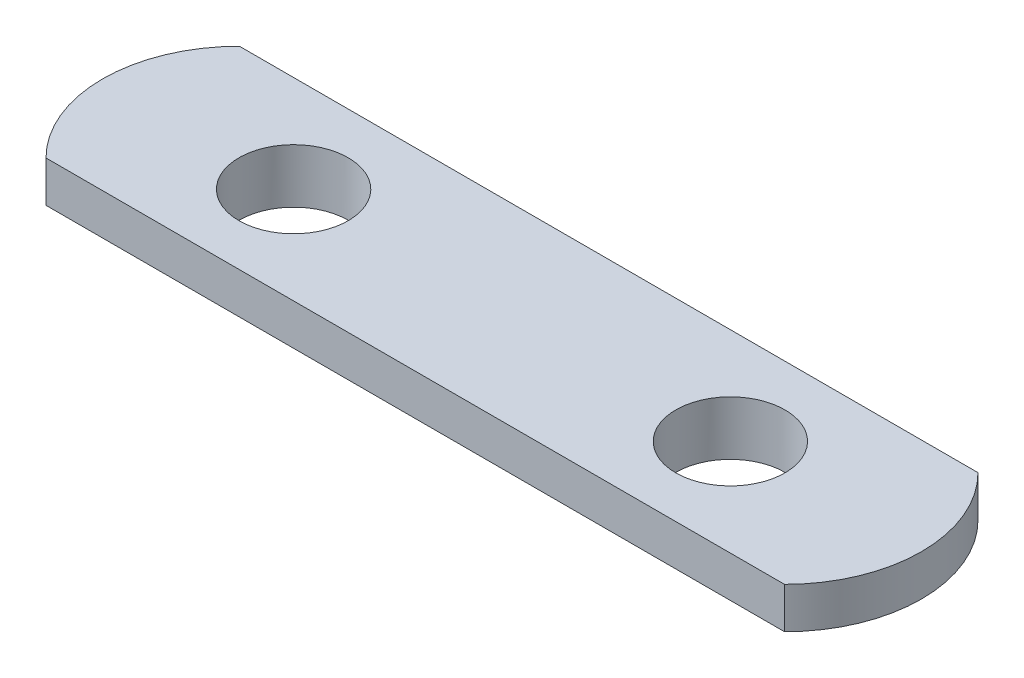
from build123d import *

# Parameters (mm, degrees)
SKETCH1_R           = 3.175
BOSS_EXTRUDE1_DEPTH = 12.7
CUT_SWEEP1_PITCH    = 1.27
SKETCH4_OUTSIDE_W   = 14
SKETCH4_OUTSIDE_H   = 14
SKETCH4_OUTSIDE_R   = 2.21262927
CUT_EXTRUDE1_DEPTH  = 1.27
CUT_EXTRUDE1_DRAFT  = -45
CUT_EXTRUDE2_DEPTH  = 2.38125
BOSS_EXTRUDE2_START = -6.35
SKETCH8_R           = 3.175
BOSS_EXTRUDE2_DEPTH = 2.3876
SKETCH9_R           = 3.5687
SKETCH9_R_2         = 3.175
BOSS_EXTRUDE3_DEPTH = 0.762


with BuildPart() as part:
    # Sketch1 → Boss-Extrude1 (new body)
    with BuildSketch(Plane(origin=(0, 0, 0), x_dir=(1, 0, 0), z_dir=(0, 1, 0))):
        with Locations(Location((-12.7, 0, 0), (0, 0, 270))):
            Circle(SKETCH1_R)
    extrude(amount=-BOSS_EXTRUDE1_DEPTH)

    # Cut-Sweep1: the profile of Sketch3 screwed along a right-hand helix of 11 turns, 8 arcs to a turn; built about Z, then put on its axis
    cut_sweep1_z = Axis((0, 0, 0), (0, 0, 1))
    cut_sweep1_corners = [(2.350110803, 0, -0.47625), (3.243740766, 0, 0.0396875), (3.243740766, 0, -1.1509375), (2.350110803, 0, -0.635)]
    with BuildLine(mode=Mode.PRIVATE) as cut_sweep1_profile:
        Line(cut_sweep1_corners[0], cut_sweep1_corners[1])
        Line(cut_sweep1_corners[1], cut_sweep1_corners[2])
        Line(cut_sweep1_corners[2], cut_sweep1_corners[3])
        Line(cut_sweep1_corners[3], cut_sweep1_corners[0])
    cut_sweep1_cap = Face(cut_sweep1_profile.wire())
    cut_sweep1_turn_angles = [0, 22.5, 45, 67.5, 90, 112.5, 135, 157.5, 180, 202.5, 225, 247.5, 270, 292.5, 315, 337.5, 360]
    cut_sweep1_turn_weights = [1, 0.9238795325112867, 1, 0.9238795325112867, 1, 0.9238795325112867, 1, 0.9238795325112867, 1, 0.9238795325112867, 1, 0.9238795325112867, 1, 0.9238795325112867, 1, 0.9238795325112867, 1]
    cut_sweep1_turn_rails = [Edge.make_bspline([Vector(p[0], p[1], 0).rotate(cut_sweep1_z, cut_sweep1_turn_angles[k]) / cut_sweep1_turn_weights[k] + Vector(0, 0, p[2] + CUT_SWEEP1_PITCH * cut_sweep1_turn_angles[k] / 360) for k in range(17)], [0, 0, 0, 1, 1, 2, 2, 3, 3, 4, 4, 5, 5, 6, 6, 7, 7, 8, 8, 8], 2, cut_sweep1_turn_weights) for p in cut_sweep1_corners]
    cut_sweep1_turn_sides = [Face.make_surface_from_curves(cut_sweep1_turn_rails[p[0]], cut_sweep1_turn_rails[p[1]]) for p in [(0, 1), (1, 2), (2, 3), (3, 0)]]
    cut_sweep1 = Plane(origin=(-12.7, -12.7, 0), x_dir=(0, 0, -1), z_dir=(0, 1, 0)) * Solid(Shell([*[p.moved(Location((0, 0, CUT_SWEEP1_PITCH * i))) for i in range(11) for p in cut_sweep1_turn_sides], cut_sweep1_cap, cut_sweep1_cap.rotate(cut_sweep1_z, 3960).moved(Location((0, 0, CUT_SWEEP1_PITCH * 3960 / 360)))]))
    add(cut_sweep1, mode=Mode.SUBTRACT)


with BuildPart() as cut_extrude1_tool:
    # Sketch4 outside → Cut-Extrude1 (with draft: the straight prism first)
    with BuildSketch(Plane.XZ.offset(12.7)):
        with Locations((-12.7, 0)):
            Rectangle(SKETCH4_OUTSIDE_W, SKETCH4_OUTSIDE_H)
        with Locations((-12.7, 0)):
            Circle(SKETCH4_OUTSIDE_R, mode=Mode.SUBTRACT)
    extrude(amount=-CUT_EXTRUDE1_DEPTH)
    # Cut-Extrude1: the draft: its side faces are tilted about the plane it starts from
    cut_extrude1_sides = [cut_extrude1_tool.faces().sort_by_distance(p)[0] for p in [
        (-12.7, -12.065, -7),
        (-5.7, -12.065, 0),
        (-12.7, -12.065, 7),
        (-19.7, -12.065, 0),
        (-14.91262927, -12.065, 0),
    ]]
    draft(cut_extrude1_sides, Plane.XZ.offset(12.7), CUT_EXTRUDE1_DRAFT)


with BuildPart() as part_1:
    add(part.part)

    # Cut-Extrude1: cut by cut_extrude1_tool
    add(cut_extrude1_tool.part, mode=Mode.SUBTRACT)

    # Sketch5 → Revolve1 (revolve)
    with BuildSketch(Plane.XY, mode=Mode.PRIVATE) as revolve1_sk:
        with BuildLine():
            Line((-12.7, 0), (-12.7, 3.3528))
            Line((-12.7, 3.3528), (-15.875, 3.3528))
            ThreePointArc((-15.875, 3.3528), (-17.240019085, 2.263204136), (-18.2499, 0.8382))
            Line((-18.2499, 0.8382), (-19.6342, 0.8382))
            Line((-19.6342, 0.8382), (-19.6342, 0))
            Line((-19.6342, 0), (-12.7, 0))
        make_face()
    revolve(revolve1_sk.sketch.rotate(Axis((-12.7, 0, 0), (0, 1, 0)), 270), axis=Axis((-12.7, 0, 0), (0, 1, 0)))

    # Sketch6 → Cut-Extrude2 (cut)
    with BuildSketch(Plane(origin=(0, 3.3528, 0), x_dir=(1, 0, 0), z_dir=(0, 1, 0))):
        Polygon((-12.7, 2.291358881), (-14.684375, 1.14567944), (-14.684375, -1.14567944), (-12.7, -2.291358881), (-10.715625, -1.14567944), (-10.715625, 1.14567944), align=None)
    extrude(amount=-CUT_EXTRUDE2_DEPTH, mode=Mode.SUBTRACT)

    # Cut-Extrude3 cone 1 section (through the dimple's axis) → Cut-Extrude3 (revolve, cut)
    with BuildSketch(Plane(origin=(-12.7, 3.3528, 0), x_dir=(0, 0, 1), z_dir=(1, 0, 0))):
        Polygon((0, 0), (2.291358881, 0), (0, 2.291358881), align=None)
    revolve(axis=Axis((-12.7, 3.3528, 0), (0, -1, 0)), mode=Mode.SUBTRACT)


with BuildPart() as body_2:
    # Body-Move/Copy1: copy of part
    add(part_1.part.moved(Location((25.4, 0, 0))))


with BuildPart() as body_3:
    # Sketch8 → Boss-Extrude2 (new body)
    with BuildSketch(Plane(origin=(0, 0, 0), x_dir=(1, 0, 0), z_dir=(0, 1, 0)).offset(BOSS_EXTRUDE2_START)):
        with BuildLine():
            Line((-21.474187891, 5.6261), (21.474187891, 5.6261))
            ThreePointArc((21.474187891, 5.6261), (23.8125, 0), (21.474187891, -5.6261))
            Line((21.474187891, -5.6261), (-21.474187891, -5.6261))
            ThreePointArc((-21.474187891, -5.6261), (-23.8125, 0), (-21.474187891, 5.6261))
        make_face()
        with Locations(Location((-12.7, 0, 0), (0, 0, 270))):
            Circle(SKETCH8_R, mode=Mode.SUBTRACT)
        with Locations(Location((12.7, 0, 0), (0, 0, 270))):
            Circle(SKETCH8_R, mode=Mode.SUBTRACT)
    extrude(amount=-BOSS_EXTRUDE2_DEPTH)

    # Sketch9 → Boss-Extrude3 (add)
    # profile 1 of 2: a face of its own
    with BuildSketch(Plane.XZ.offset(8.7376)):
        with Locations(Location((-12.7, 0, 0), (0, 0, 90))):
            Circle(SKETCH9_R)
        with Locations(Location((-12.7, 0, 0), (0, 0, 90))):
            Circle(SKETCH9_R_2, mode=Mode.SUBTRACT)
    # profile 2 of 2: a face of its own
    with BuildSketch(Plane.XZ.offset(8.7376)):
        with Locations(Location((12.7, 0, 0), (0, 0, 90))):
            Circle(SKETCH9_R)
        with Locations(Location((12.7, 0, 0), (0, 0, 90))):
            Circle(SKETCH9_R_2, mode=Mode.SUBTRACT)
    extrude(amount=BOSS_EXTRUDE3_DEPTH)


solid = body_3.part
